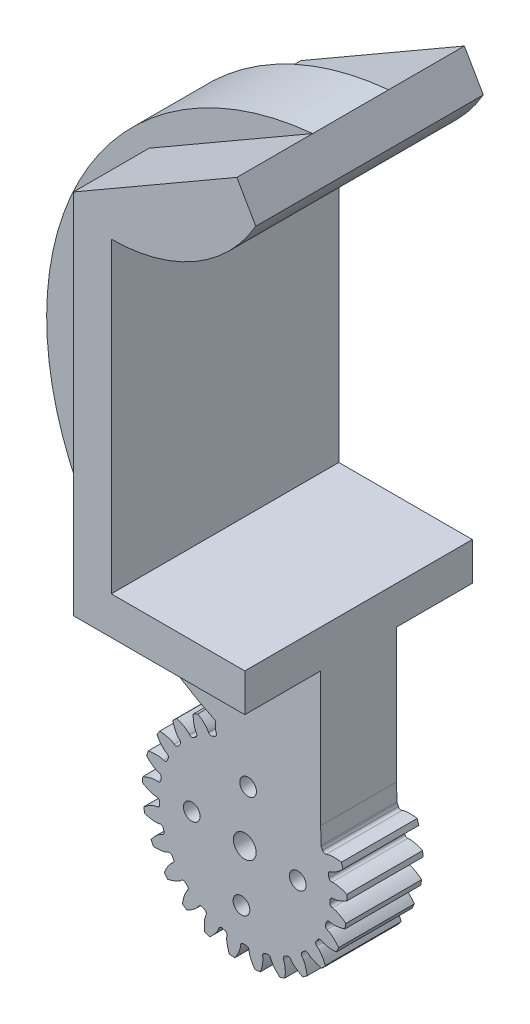
from build123d import *

# Parameters (mm, degrees)
SKETCH_1_R           = 13.5
LASHENA_DEPTH        = 10
CUT_EXTRUDEA_DEPTH   = 30
WWW_KYTOOL_CN_COUNT  = 25
EXTRUDE_2_DEPTH      = 10
EXTRUDE_2_DEPTH_BACK = 20
CUT_EXTRUDE_START    = -10
CUT_EXTRUDE_2_DEPTH  = 10
EXTRUDE_3_DEPTH      = 10
CUT_EXTRUDE_3_DEPTH  = 10
SKETCH_12_R          = 1.5
SKETCH_12_R_2        = 1.1
CUT_EXTRUDE_4_DEPTH  = 129.242745396
EXTRUDE_4_DEPTH      = 10
CUT_EXTRUDE_5_DEPTH  = 10


with BuildPart() as part:
    # 草图1 → LaShenA (new body)
    with BuildSketch(Plane.XY):
        Circle(SKETCH_1_R)
    extrude(amount=LASHENA_DEPTH)

    # SketchA → Cut-ExtrudeA (cut)
    with BuildSketch(Plane.XY.offset(10)):
        with BuildLine():
            ThreePointArc((-3.984350063, 10.520810547), (-4.141401218, 10.459985466), (-4.297524216, 10.396816129))
            ThreePointArc((-4.297524216, 10.396816129), (-4.579677411, 10.393549891), (-4.786294021, 10.585723434))
            add(Edge.make_bspline(
                [(-4.786294021, 10.585723434), (-4.804689966, 10.624676134), (-4.836949244, 10.69266095), (-4.880435936, 10.771422965), (-4.914918146, 10.825150817), (-4.943317749, 10.867301695), (-4.977370459, 10.915048119), (-5.017326263, 10.968161569), (-5.063499475, 11.026352218), (-5.116169679, 11.089334691), (-5.175613294, 11.156807226), (-5.24209304, 11.228458772), (-5.315860723, 11.303967278), (-5.397155902, 11.383000734), (-5.486205826, 11.465217384), (-5.583225013, 11.550266205), (-5.688414947, 11.637787319), (-5.801963757, 11.727412442), (-5.924045932, 11.818765334), (-6.05482202, 11.911462258), (-6.194438398, 12.005112443), (-6.343026893, 12.099318618), (-6.557737569, 12.227806993), (-6.725924413, 12.319640738), (-6.841804759, 12.379242901)],
                knots=[0.117691322, 0.117691322, 0.117691322, 0.117691322, 0.158671831, 0.189773021, 0.203463493, 0.219643142, 0.238311966, 0.259469968, 0.283117146, 0.3092535, 0.337879031, 0.368993739, 0.402597623, 0.438690683, 0.47727292, 0.518344334, 0.561904924, 0.60795469, 0.656493633, 0.707521753, 0.761039049, 0.817045522, 0.875541172, 1, 1, 1, 1], degree=3))
            ThreePointArc((-6.841804759, 12.379242901), (-5.206795461, 13.150864161), (-3.486713877, 13.707617353))
            add(Edge.make_bspline(
                [(-3.757368158, 10.993104002), (-3.770623049, 11.034092189), (-3.793645857, 11.105733983), (-3.815861732, 11.19291771), (-3.827504528, 11.255688326), (-3.83565637, 11.305855859), (-3.843517689, 11.363972189), (-3.85074982, 11.430041857), (-3.856925238, 11.504068754), (-3.861644781, 11.586036236), (-3.864500379, 11.675913552), (-3.865087588, 11.773653798), (-3.863002391, 11.879194584), (-3.85784288, 11.992457874), (-3.849209448, 12.1133501), (-3.836705428, 12.241762226), (-3.819937593, 12.377569837), (-3.798516691, 12.52063325), (-3.772057973, 12.670797641), (-3.740181719, 12.827893183), (-3.702513722, 12.991735218), (-3.658685936, 13.162124388), (-3.590124934, 13.402767955), (-3.530386525, 13.584843691), (-3.486713877, 13.707617353)],
                knots=[0.117691322, 0.117691322, 0.117691322, 0.117691322, 0.158671831, 0.189773021, 0.203463493, 0.219643142, 0.238311966, 0.259469968, 0.283117146, 0.3092535, 0.337879031, 0.368993739, 0.402597623, 0.438690683, 0.47727292, 0.518344334, 0.561904924, 0.60795469, 0.656493633, 0.707521753, 0.761039049, 0.817045522, 0.875541172, 1, 1, 1, 1], degree=3))
            ThreePointArc((-3.757368158, 10.993104002), (-3.776433342, 10.711576716), (-3.984350063, 10.520810547))
        make_face()
    cut_extrudea = extrude(amount=-CUT_EXTRUDEA_DEPTH, mode=Mode.SUBTRACT)

    # www.KYTool.cn: Cut-ExtrudeA ×25 about axis
    www_kytool_cn_axis = Axis((0, 0, -88.99), (0, 0, 1))
    for i in range(1, WWW_KYTOOL_CN_COUNT):
        add(cut_extrudea.rotate(www_kytool_cn_axis, i * 360 / WWW_KYTOOL_CN_COUNT), mode=Mode.SUBTRACT)

    # 草图4 → 凸台-拉伸2 (add, two sides: drawn at the far end of the back side and taken through both)
    with BuildSketch(Plane(origin=(-1.008617318, -38.329057813, 10), x_dir=(1, 0, 0), z_dir=(0, 0, 1)).offset(-EXTRUDE_2_DEPTH_BACK)):
        with BuildLine():
            Line((11.008617318, 38.329057813), (11.008617318, 68.329057813))
            Line((11.008617318, 68.329057813), (-6.591382682, 68.329057813))
            Line((-6.591382682, 68.329057813), (-6.591382682, 108.829057813))
            ThreePointArc((-6.591382682, 108.829057813), (4.408617318, 111.77649893), (12.461176202, 119.829057813))
            Line((12.461176202, 119.829057813), (9.961176202, 124.159184832))
            Line((9.961176202, 124.159184832), (-11.591382682, 111.715809159))
            Line((-11.591382682, 111.715809159), (-11.591382682, 63.329057813))
            Line((-11.591382682, 63.329057813), (6.008617318, 63.329057813))
            Line((6.008617318, 63.329057813), (6.008617318, 46.989311851))
            ThreePointArc((6.008617318, 46.989311851), (9.668871356, 43.329057813), (11.008617318, 38.329057813))
        make_face()
    extrude(amount=EXTRUDE_2_DEPTH + EXTRUDE_2_DEPTH_BACK)

    # 草图6 → 切除-拉伸2 (cut)
    with BuildSketch(Plane(origin=(-1.008617318, -38.329057813, 20), x_dir=(1, 0, 0), z_dir=(0, 0, 1)).offset(CUT_EXTRUDE_START)):
        with BuildLine():
            Line((11.008617318, 38.329057813), (11.008617318, 63.329057813))
            Line((11.008617318, 63.329057813), (6.008617318, 63.329057813))
            Line((6.008617318, 63.329057813), (6.008617318, 46.989311851))
            ThreePointArc((6.008617318, 46.989311851), (9.668871356, 43.329057813), (11.008617318, 38.329057813))
        make_face()
    extrude(amount=CUT_EXTRUDE_2_DEPTH, mode=Mode.SUBTRACT)

    # 草图8 → 凸台-拉伸3 (add)
    with BuildSketch(Plane(origin=(-1.008617318, -38.329057813, 10), x_dir=(1, 0, 0), z_dir=(0, 0, 1))):
        with BuildLine():
            Line((-11.591382682, 111.715809159), (9.961176202, 124.159184832))
            ThreePointArc((9.961176202, 124.159184832), (-25.062056366, 87.696978372), (6.008617318, 47.812989652))
            Line((6.008617318, 47.812989652), (6.008617318, 63.329057813))
            Line((6.008617318, 63.329057813), (-11.591382682, 63.329057813))
            Line((-11.591382682, 63.329057813), (-11.591382682, 111.715809159))
        make_face()
    extrude(amount=-EXTRUDE_3_DEPTH)

    # 草图10 → 切除-拉伸3 (cut)
    with BuildSketch(Plane(origin=(-1.008617318, -38.329057813, -10), x_dir=(-1, 0, 0), z_dir=(0, 0, -1))):
        with BuildLine():
            Line((-6.008617318, 63.329057813), (-6.008617318, 46.989311851))
            ThreePointArc((-6.008617318, 46.989311851), (-9.668871356, 43.329057813), (-11.008617318, 38.329057813))
            Line((-11.008617318, 38.329057813), (-11.008617318, 63.329057813))
            Line((-11.008617318, 63.329057813), (-6.008617318, 63.329057813))
        make_face()
    extrude(amount=-CUT_EXTRUDE_3_DEPTH, mode=Mode.SUBTRACT)

    # 草图12 → 切除-拉伸4 (cut, through all)
    with BuildSketch(Plane(origin=(-1.008617318, -38.329057813, 10), x_dir=(1, 0, 0), z_dir=(0, 0, 1))):
        with Locations((1.008617318, 38.329057813)):
            Circle(SKETCH_12_R)
        with Locations((-5.977569781, 38.76859145)):
            Circle(SKETCH_12_R_2)
        with Locations((1.448150955, 45.315244912)):
            Circle(SKETCH_12_R_2)
        with Locations((7.994804417, 37.889524176)):
            Circle(SKETCH_12_R_2)
        with Locations((0.569083682, 31.342870714)):
            Circle(SKETCH_12_R_2)
    extrude(amount=-CUT_EXTRUDE_4_DEPTH, mode=Mode.SUBTRACT)

    # 草图13 → 凸台-拉伸4 (add)
    with BuildSketch(Plane.XY.offset(10)):
        with BuildLine():
            ThreePointArc((-1.242755191, 11.181147505), (-1.171656629, 11.196035655), (-1.104690091, 11.224180731))
            ThreePointArc((-1.104690091, 11.224180731), (-1.570284163, 11.402857707), (-2.033532347, 11.587531535))
            add(Edge.make_bspline(
                [(-2.033532347, 11.587531535), (-2.032082424, 11.581540065), (-2.020815424, 11.533792188), (-2.011492286, 11.485760201), (-2.003361426, 11.443456386)],
                knots=[0.953131762, 0.953131762, 0.953131762, 0.953131762, 0.959019491, 1, 1, 1, 1], degree=3))
            ThreePointArc((-2.003361426, 11.443456386), (-1.851027674, 11.205936868), (-1.57692656, 11.138931844))
            ThreePointArc((-1.57692656, 11.138931844), (-1.409998878, 11.16129039), (-1.242755191, 11.181147505))
        make_face()
    extrude(amount=-EXTRUDE_4_DEPTH)

    # 草图14 → 切除-拉伸5 (cut)
    with BuildSketch(Plane.XY.offset(10).offset(CUT_EXTRUDE_START)):
        with BuildLine():
            Line((10, 7.312754527), (10.068009146, 5.097132041))
            ThreePointArc((10.068009146, 5.097132041), (10.117688156, 5.296956094), (10.264301038, 5.441532437))
            add(Edge.make_bspline(
                [(11.586916571, 6.927724329), (11.534069284, 6.834672524), (11.452818253, 6.699299558), (11.339962754, 6.526885227), (11.257644274, 6.407932871), (11.176900793, 6.29745501), (11.098111682, 6.195287008), (11.021648759, 6.101250377), (10.947875824, 6.015153064), (10.877148228, 5.936789726), (10.809812368, 5.865942126), (10.74620547, 5.802379174), (10.686654468, 5.7458582), (10.631477885, 5.696122279), (10.580978088, 5.652910298), (10.535464068, 5.61592676), (10.495179591, 5.584936522), (10.443722914, 5.547148754), (10.36784687, 5.498802366), (10.302021783, 5.462337942), (10.264301038, 5.441532437)],
                knots=[0.358992653, 0.358992653, 0.358992653, 0.358992653, 0.461197689, 0.509736632, 0.555786399, 0.599346989, 0.640418402, 0.679000639, 0.7150937, 0.748697584, 0.779812291, 0.808437822, 0.834574177, 0.858221354, 0.879379356, 0.898048181, 0.914227829, 0.927918301, 0.959019491, 1, 1, 1, 1], degree=3))
            ThreePointArc((11.586916571, 6.927724329), (11.398426994, 7.233661732), (11.201861514, 7.534474011))
            add(Edge.make_bspline(
                [(10, 7.312754527), (10.033755727, 7.323491623), (10.103822532, 7.344743423), (10.213366196, 7.374899897), (10.331009413, 7.404046768), (10.457000556, 7.431836268), (10.591342816, 7.457855968), (10.73402363, 7.481692506), (10.938080315, 7.510396763), (11.095164443, 7.526275888), (11.201861514, 7.534474011)],
                knots=[0.368766414, 0.368766414, 0.368766414, 0.368766414, 0.402597623, 0.438690683, 0.47727292, 0.518344334, 0.561904924, 0.60795469, 0.656493633, 0.758698669, 0.758698669, 0.758698669, 0.758698669], degree=3))
        make_face()
    extrude(amount=CUT_EXTRUDE_5_DEPTH, mode=Mode.SUBTRACT)


solid = part.part
